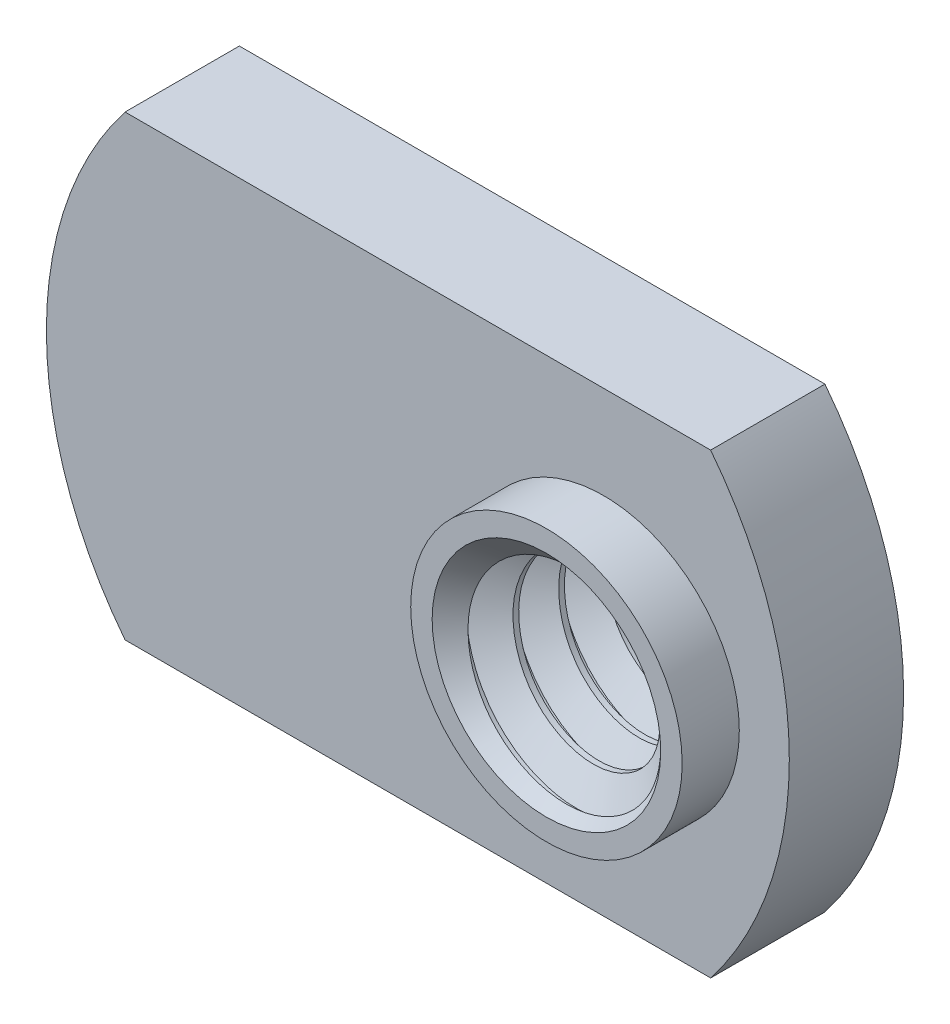
from build123d import *

# Parameters (mm, degrees)
SKETCH1_R          = 3.175
EXTRUDE1_DEPTH     = 3.175
SKETCH2_R          = 3.7703125
SKETCH2_R_2        = 3.175
EXTRUDE2_DEPTH     = 1.5875
SWEEP1_PITCH       = 1.27
CUT_EXTRUDE1_DEPTH = 15.484673362
SKETCH7_R          = 3.7703125
CUT_EXTRUDE3_DEPTH = 14.018467988


with BuildPart() as part:
    # Sketch1 → Extrude1 (new body)
    with BuildSketch(Plane.XY):
        with BuildLine():
            Line((-8.13351717, 6.35), (8.13351717, 6.35))
            ThreePointArc((8.13351717, 6.35), (10.31875, 0), (8.13351717, -6.35))
            Line((8.13351717, -6.35), (-8.13351717, -6.35))
            ThreePointArc((-8.13351717, -6.35), (-10.31875, 0), (-8.13351717, 6.35))
        make_face()
        with Locations((5.159375, 0)):
            Circle(SKETCH1_R, mode=Mode.SUBTRACT)
    extrude(amount=EXTRUDE1_DEPTH)

    # Sketch2 → Extrude2 (add)
    with BuildSketch(Plane.XY.offset(3.175)):
        with Locations((5.159375, 0)):
            Circle(SKETCH2_R)
        with Locations((5.159375, 0)):
            Circle(SKETCH2_R_2, mode=Mode.SUBTRACT)
    extrude(amount=EXTRUDE2_DEPTH)

    # Sweep1: the profile of Sketch4 profile screwed along a right-hand helix of 6.25 turns, 6 arcs to a turn; built about Z, then put on its axis
    sweep1_z = Axis((0, 0, 0), (0, 0, 1))
    sweep1_corners = [(3.1753, 0, -1.111423205), (3.1753, 0, 0.000173205), (2.350110803, 0, -0.47625), (2.350110803, 0, -0.635)]
    with BuildLine(mode=Mode.PRIVATE) as sweep1_profile:
        Line(sweep1_corners[0], sweep1_corners[1])
        Line(sweep1_corners[1], sweep1_corners[2])
        Line(sweep1_corners[2], sweep1_corners[3])
        Line(sweep1_corners[3], sweep1_corners[0])
    sweep1_cap = Face(sweep1_profile.wire())
    sweep1_turn_angles = [0, 30, 60, 90, 120, 150, 180, 210, 240, 270, 300, 330, 360]
    sweep1_turn_weights = [1, 0.8660254037844387, 1, 0.8660254037844387, 1, 0.8660254037844387, 1, 0.8660254037844387, 1, 0.8660254037844387, 1, 0.8660254037844387, 1]
    sweep1_turn_rails = [Edge.make_bspline([Vector(p[0], p[1], 0).rotate(sweep1_z, sweep1_turn_angles[k]) / sweep1_turn_weights[k] + Vector(0, 0, p[2] + SWEEP1_PITCH * sweep1_turn_angles[k] / 360) for k in range(13)], [0, 0, 0, 1, 1, 2, 2, 3, 3, 4, 4, 5, 5, 6, 6, 6], 2, sweep1_turn_weights) for p in sweep1_corners]
    sweep1_turn_sides = [Face.make_surface_from_curves(sweep1_turn_rails[p[0]], sweep1_turn_rails[p[1]]) for p in [(0, 1), (1, 2), (2, 3), (3, 0)]]
    sweep1_last_angles = [2160, 2190, 2220, 2235, 2250]
    sweep1_last_weights = [1, 0.8660254037844387, 1, 0.965925826289056, 1]
    sweep1_last_rails = [Edge.make_bspline([Vector(p[0], p[1], 0).rotate(sweep1_z, sweep1_last_angles[k]) / sweep1_last_weights[k] + Vector(0, 0, p[2] + SWEEP1_PITCH * sweep1_last_angles[k] / 360) for k in range(5)], [0, 0, 0, 1, 1, 2, 2, 2], 2, sweep1_last_weights) for p in sweep1_corners]
    sweep1_last_sides = [Face.make_surface_from_curves(sweep1_last_rails[p[0]], sweep1_last_rails[p[1]]) for p in [(0, 1), (1, 2), (2, 3), (3, 0)]]
    sweep1 = Plane(origin=(5.159375, 0, 0), x_dir=(-1, 0, 0), z_dir=(0, 0, 1)) * Solid(Shell([*[p.moved(Location((0, 0, SWEEP1_PITCH * i))) for i in range(6) for p in sweep1_turn_sides], *sweep1_last_sides, sweep1_cap, sweep1_cap.rotate(sweep1_z, 2250).moved(Location((0, 0, SWEEP1_PITCH * 2250 / 360)))]))
    add(sweep1)

    # Sketch5 → Cut-Extrude1 (cut, through all)
    with BuildSketch(Plane(origin=(0, 0, 0), x_dir=(-1, 0, 0), z_dir=(0, 0, -1))):
        with BuildLine():
            Line((-8.13351717, -6.35), (8.13351717, -6.35))
            ThreePointArc((8.13351717, -6.35), (10.31875, 0), (8.13351717, 6.35))
            Line((8.13351717, 6.35), (-8.13351717, 6.35))
            ThreePointArc((-8.13351717, 6.35), (-10.31875, 0), (-8.13351717, -6.35))
        make_face()
    extrude(amount=CUT_EXTRUDE1_DEPTH, mode=Mode.SUBTRACT)

    # Cut-Extrude2 cone 1 section (through the dimple's axis) → Cut-Extrude2 (revolve, cut)
    with BuildSketch(Plane.YZ.offset(5.159375)):
        Polygon((0, 0), (3.175, 0), (0, 3.175), align=None)
    revolve(axis=Axis((5.159375, 0, 0), (0, 0, 1)), mode=Mode.SUBTRACT)

    # Sketch7 → Cut-Extrude3 (cut, through all)
    with BuildSketch(Plane.XY.offset(4.7625)):
        with Locations((5.159375, 0)):
            Circle(SKETCH7_R)
    extrude(amount=CUT_EXTRUDE3_DEPTH, mode=Mode.SUBTRACT)

    # Cut-Extrude4 cone 1 section (through the dimple's axis) → Cut-Extrude4 (revolve, cut)
    with BuildSketch(Plane(origin=(5.159375, 0, 4.7625), x_dir=(0, -1, 0), z_dir=(1, 0, 0))):
        Polygon((0, 0), (3.175, 0), (0, 3.175), align=None)
    revolve(axis=Axis((5.159375, 0, 4.7625), (0, 0, -1)), mode=Mode.SUBTRACT)


solid = part.part
